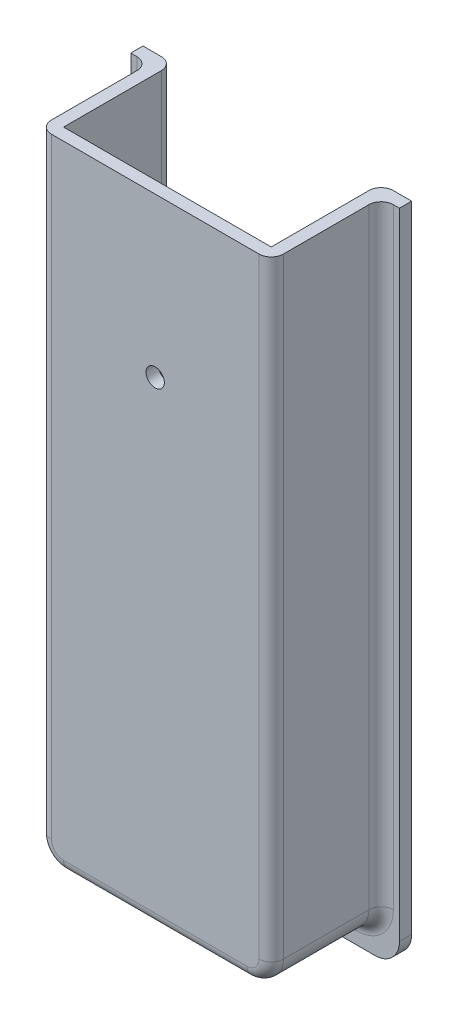
from build123d import *

# Parameters (mm, degrees)
ESQUISSE1_W             = 34
ESQUISSE1_H             = 100
BOSS_EXTRU_1_DEPTH      = 18
COQUE1_T                = 2
ESQUISSE2_W             = 34
ESQUISSE2_H             = 18
ENL_V_MAT_EXTRU_1_DEPTH = 18
CONG_1_R                = 2
ESQUISSE5_W             = 1.999683034
ESQUISSE5_H             = 104
BOSS_EXTRU_2_DEPTH      = 3
ESQUISSE6_W             = 1.999683034
ESQUISSE6_H             = 104
BOSS_EXTRU_3_DEPTH      = 3
ESQUISSE7_W             = 44
ESQUISSE7_H             = 1.999683034
BOSS_EXTRU_4_DEPTH      = 4
CONG_2_R                = 4
CONG_3_R                = 2
CONG_5_R                = 2
ESQUISSE8_R             = 1.5
ENL_V_MAT_EXTRU_2_DEPTH = 10


with BuildPart() as part:
    # Esquisse1 → Boss.-Extru.1 (new body)
    with BuildSketch(Plane.XY):
        with Locations((17, 50)):
            Rectangle(ESQUISSE1_W, ESQUISSE1_H)
    extrude(amount=BOSS_EXTRU_1_DEPTH)

    # Coque1
    coque1_openings = [part.faces().sort_by_distance(p)[0] for p in [
        (17, 50, 0),
    ]]
    offset(amount=COQUE1_T, openings=coque1_openings, kind=Kind.INTERSECTION)

    # Esquisse2 → Enlèv. mat.-Extru.1 (cut)
    with BuildSketch(Plane.XZ.offset(-100)):
        with Locations((17, 9)):
            Rectangle(ESQUISSE2_W, ESQUISSE2_H)
    extrude(amount=-ENL_V_MAT_EXTRU_1_DEPTH, mode=Mode.SUBTRACT)

    # Congé1
    cong_1_edges = [part.edges().sort_by_distance(p)[0] for p in [
        (36, 50, 20),
        (-2, 50, 20),
        (17, -2, 20),
    ]]
    fillet(cong_1_edges, radius=CONG_1_R)

    # Esquisse5 → Boss.-Extru.2 (add)
    with BuildSketch(Plane.ZY.offset(2)):
        with Locations((0.999841517, 50)):
            Rectangle(ESQUISSE5_W, ESQUISSE5_H)
    extrude(amount=BOSS_EXTRU_2_DEPTH)

    # Esquisse6 → Boss.-Extru.3 (add)
    with BuildSketch(Plane(origin=(36, 0, 0), x_dir=(0, 0, -1), z_dir=(1, 0, 0))):
        with Locations((-0.999841517, 50)):
            Rectangle(ESQUISSE6_W, ESQUISSE6_H)
    extrude(amount=BOSS_EXTRU_3_DEPTH)

    # Esquisse7 → Boss.-Extru.4 (add)
    with BuildSketch(Plane.XZ.offset(2)):
        with Locations((17, 0.999841517)):
            Rectangle(ESQUISSE7_W, ESQUISSE7_H)
    extrude(amount=BOSS_EXTRU_4_DEPTH)

    # Congé2
    # the kernel refuses this fillet: 4 mm, written as the material it takes off along each edge
    with BuildSketch(Plane(origin=(2, 2, 20), x_dir=(-1, 0, 0), z_dir=(0, 1, 0))) as cong_2_piece_1:
        with BuildLine():
            CenterArc((2, -2), 2, 0, 90)
            Line((4, -2), (4, 0))
            Line((4, 0), (2, 0))
        make_face()
    revolve(axis=Axis((2, 2, 20), (0, 0, 1)), revolution_arc=90, mode=Mode.SUBTRACT)
    with BuildSketch(Plane(origin=(32, 2, 20), x_dir=(0, -1, 0), z_dir=(-1, 0, 0))) as cong_2_piece_2:
        with BuildLine():
            CenterArc((2, -2), 2, 0, 90)
            Line((4, -2), (4, 0))
            Line((4, 0), (2, 0))
        make_face()
    revolve(axis=Axis((32, 2, 20), (0, 0, 1)), revolution_arc=90, mode=Mode.SUBTRACT)
    with BuildSketch(Plane(origin=(36, -2, 1.999683034), x_dir=(-1, 0, 0), z_dir=(0, 0, 1)), Plane(origin=(-2, -2, 20), x_dir=(1, 0, 0), z_dir=(0, 0, -1))) as cong_2_piece_3:
        with BuildLine():
            CenterArc((CONG_2_R, -CONG_2_R), CONG_2_R, 90, 90)
            Line((0, -CONG_2_R), (0, 0))
            Line((0, 0), (CONG_2_R, 0))
        make_face()
    extrude(amount=18.000316966, mode=Mode.SUBTRACT)
    with BuildSketch(Plane(origin=(39, -6, 11.999683034), x_dir=(0, 1, 0), z_dir=(0, 0, -1))) as cong_2_piece_4:
        with BuildLine():
            CenterArc((CONG_2_R, -CONG_2_R), CONG_2_R, 90, 90)
            Line((0, -CONG_2_R), (0, 0))
            Line((0, 0), (CONG_2_R, 0))
        make_face()
    extrude(amount=21.999683034, mode=Mode.SUBTRACT)
    with BuildSketch(Plane(origin=(-5, -6, -10), x_dir=(1, 0, 0), z_dir=(0, 0, 1))) as cong_2_piece_5:
        with BuildLine():
            CenterArc((CONG_2_R, CONG_2_R), CONG_2_R, 180, 90)
            Line((0, CONG_2_R), (0, 0))
            Line((0, 0), (CONG_2_R, 0))
        make_face()
    extrude(amount=21.999683034, mode=Mode.SUBTRACT)

    # Congé3
    cong_3_edges = [part.edges().sort_by_distance(p)[0] for p in [
        (17, -2, 1.999683034),
        (-2, 52, 1.999683034),
        (34.828427125, -0.828427125, 1.999683034),
        (-0.828427125, -0.828427125, 1.999683034),
        (36, 52, 1.999683034),
    ]]
    fillet(cong_3_edges, radius=CONG_3_R)

    # Congé5
    cong_5_edges = [part.edges().sort_by_distance(p)[0] for p in [
        (0, 51, 0),
        (17, 0, 0),
        (34, 51, 0),
    ]]
    fillet(cong_5_edges, radius=CONG_5_R)

    # Esquisse8 → Enlèv. mat.-Extru.2 (cut)
    with BuildSketch(Plane.XY.offset(20)):
        with Locations((17, 76)):
            Circle(ESQUISSE8_R)
    extrude(amount=-ENL_V_MAT_EXTRU_2_DEPTH, mode=Mode.SUBTRACT)


solid = part.part
